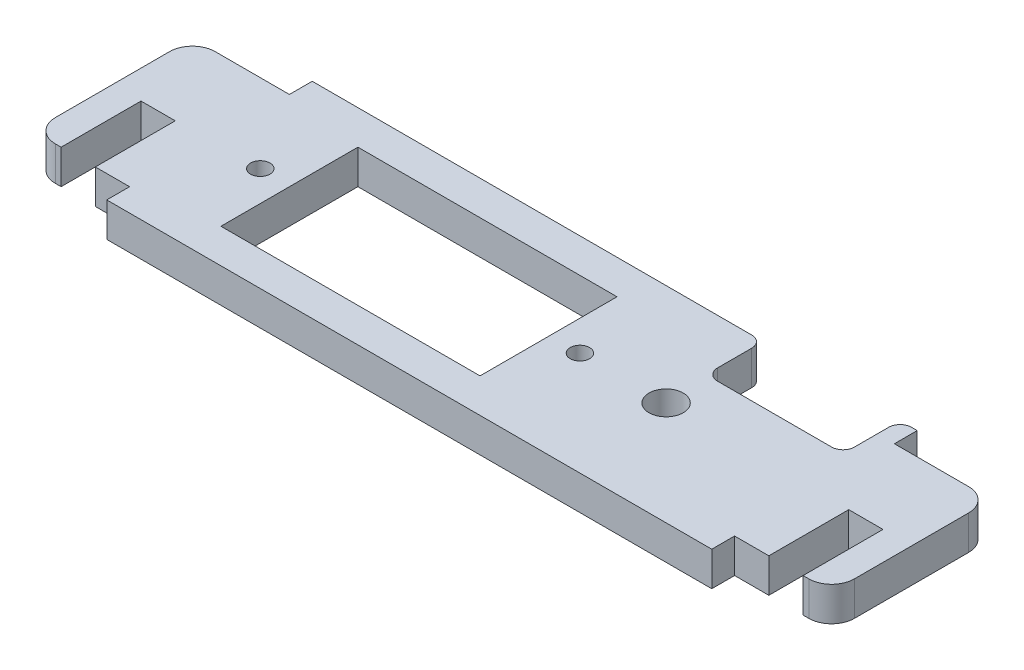
from build123d import *

# Parameters (mm, degrees)
BOSS_EXTRUDE1_DEPTH = 3
SKETCH2_W           = 22.7
SKETCH2_H           = 12
CUT_EXTRUDE1_DEPTH  = 3
SKETCH3_W           = 3
SKETCH3_H           = 7
CUT_EXTRUDE2_DEPTH  = 3
SKETCH4_R           = 1.5
CUT_EXTRUDE3_DEPTH  = 3
SKETCH5_R           = 0.85
CUT_EXTRUDE4_DEPTH  = 3


with BuildPart() as part:
    # Sketch1 → Boss-Extrude1 (new body)
    with BuildSketch(Plane(origin=(0, 0, 0), x_dir=(1, 0, 0), z_dir=(0, 1, 0))):
        with BuildLine():
            Line((-9.820632273, 11.009972833), (-9.820632273, 1.009972833))
            ThreePointArc((-9.820632273, 1.009972833), (-10.40641871, -0.404240729), (-11.820632273, -0.990027167))
            Line((-11.820632273, -0.990027167), (-18.320632273, -0.990027167))
            Line((-18.320632273, -0.990027167), (-18.320632273, -2.990027167))
            Line((-18.320632273, -2.990027167), (-71.320632273, -2.990027167))
            Line((-71.320632273, -2.990027167), (-71.320632273, -0.990027167))
            Line((-71.320632273, -0.990027167), (-77.820632273, -0.990027167))
            ThreePointArc((-77.820632273, -0.990027167), (-79.234845835, -0.404240729), (-79.820632273, 1.009972833))
            Line((-79.820632273, 1.009972833), (-79.820632273, 11.009972833))
            ThreePointArc((-79.820632273, 11.009972833), (-79.234845835, 12.424186396), (-77.820632273, 13.009972833))
            Line((-77.820632273, 13.009972833), (-71.320632273, 13.009972833))
            Line((-71.320632273, 13.009972833), (-71.320632273, 15.009972833))
            Line((-71.320632273, 15.009972833), (-32.820632273, 15.009972833))
            ThreePointArc((-32.820632273, 15.009972833), (-32.113525492, 14.717079615), (-31.820632273, 14.009972833))
            Line((-31.820632273, 14.009972833), (-31.820632273, 11.009972833))
            ThreePointArc((-31.820632273, 11.009972833), (-31.527739054, 10.302866052), (-30.820632273, 10.009972833))
            Line((-30.820632273, 10.009972833), (-20.820632273, 10.009972833))
            ThreePointArc((-20.820632273, 10.009972833), (-20.113525492, 10.302866052), (-19.820632273, 11.009972833))
            Line((-19.820632273, 11.009972833), (-19.820632273, 14.009972833))
            ThreePointArc((-19.820632273, 14.009972833), (-19.527739054, 14.717079615), (-18.820632273, 15.009972833))
            Line((-18.820632273, 15.009972833), (-18.320632273, 15.009972833))
            Line((-18.320632273, 15.009972833), (-18.320632273, 13.009972833))
            Line((-18.320632273, 13.009972833), (-11.820632273, 13.009972833))
            ThreePointArc((-11.820632273, 13.009972833), (-10.40641871, 12.424186396), (-9.820632273, 11.009972833))
        make_face()
    extrude(amount=BOSS_EXTRUDE1_DEPTH)

    # Sketch2 → Cut-Extrude1 (cut)
    with BuildSketch(Plane(origin=(0, 3, 0), x_dir=(1, 0, 0), z_dir=(0, 1, 0))):
        with Locations((-52.970632273, 6.009972833)):
            Rectangle(SKETCH2_W, SKETCH2_H)
    extrude(amount=-CUT_EXTRUDE1_DEPTH, mode=Mode.SUBTRACT)

    # Sketch3 → Cut-Extrude2 (cut)
    with BuildSketch(Plane(origin=(0, 3, 0), x_dir=(1, 0, 0), z_dir=(0, 1, 0))):
        with Locations((-13.820632273, 2.509972833)):
            Rectangle(SKETCH3_W, SKETCH3_H)
        with Locations((-75.820632273, 2.509972833)):
            Rectangle(SKETCH3_W, SKETCH3_H)
    extrude(amount=-CUT_EXTRUDE2_DEPTH, mode=Mode.SUBTRACT)

    # Sketch4 → Cut-Extrude3 (cut)
    with BuildSketch(Plane(origin=(0, 3, 0), x_dir=(1, 0, 0), z_dir=(0, 1, 0))):
        with Locations((-31.420632273, 6.109972833)):
            Circle(SKETCH4_R)
    extrude(amount=-CUT_EXTRUDE3_DEPTH, mode=Mode.SUBTRACT)

    # Sketch5 → Cut-Extrude4 (cut)
    with BuildSketch(Plane(origin=(0, 3, 0), x_dir=(1, 0, 0), z_dir=(0, 1, 0))):
        with Locations((-38.970632273, 6.109972833)):
            Circle(SKETCH5_R)
        with Locations((-66.970632273, 6.109972833)):
            Circle(SKETCH5_R)
    extrude(amount=-CUT_EXTRUDE4_DEPTH, mode=Mode.SUBTRACT)


solid = part.part
